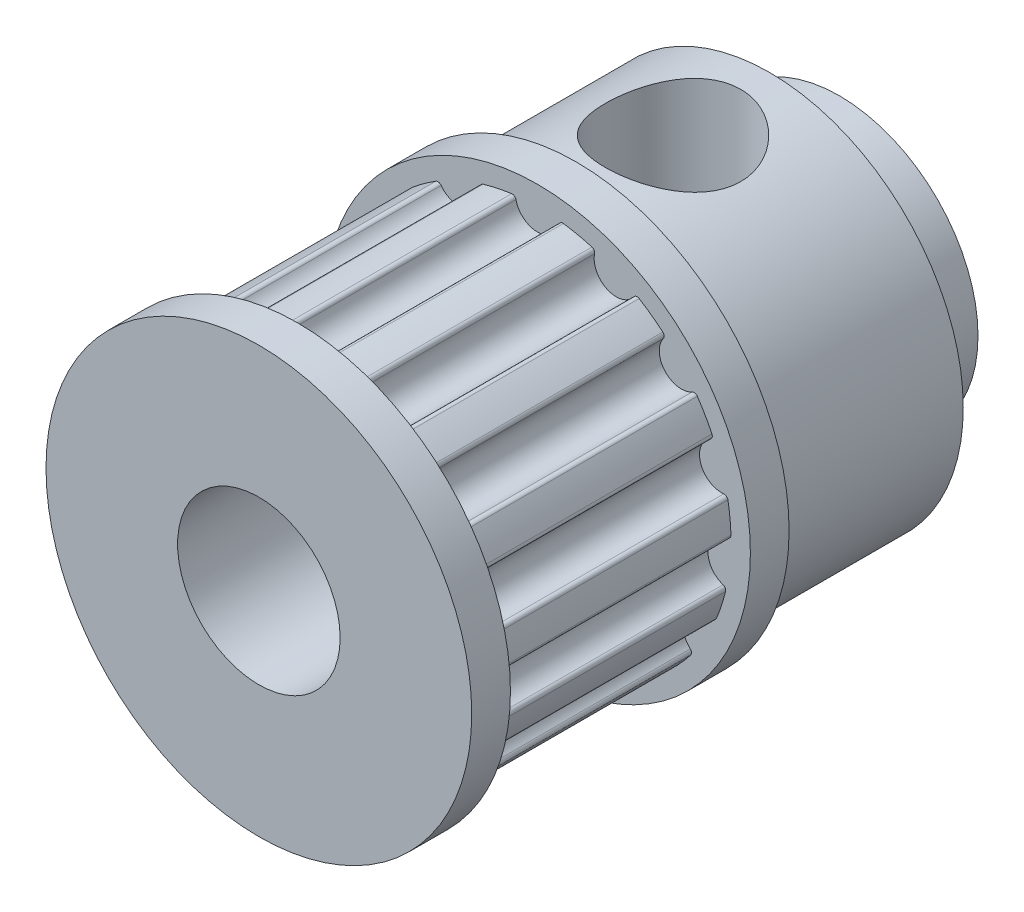
from build123d import *

# Parameters (mm, degrees)
ESBO_O1_R                = 5
ESBO_O1_R_2              = 2.1
RESSALTO_EXTRUS_O1_DEPTH = 13.2
RESSALTO_EXTRUS_O2_START = -15
ESBO_O2_R                = 3.581
ESBO_O2_R_2              = 2.1
RESSALTO_EXTRUS_O2_DEPTH = 15
ESBO_O7_R                = 0.57
CORTE_EXTRUS_O2_DEPTH    = 8
FILETE1_R                = 0.1
ESBO_O3_R                = 5.5
ESBO_O3_R_2              = 2.1
RESSALTO_EXTRUS_O3_DEPTH = 1
RESSALTO_EXTRUS_O4_START = -1
ESBO_O4_R                = 5.5
ESBO_O4_R_2              = 2.1
RESSALTO_EXTRUS_O4_DEPTH = 1
ESBO_O6_R                = 1.75
CORTE_EXTRUS_O1_DEPTH    = 16.321227177
FILETE2_R                = 0.5


with BuildPart() as part:
    # Esboço1 → Ressalto-extrusão1 (new body)
    with BuildSketch(Plane.XY):
        Circle(ESBO_O1_R)
        Circle(ESBO_O1_R_2, mode=Mode.SUBTRACT)
    extrude(amount=RESSALTO_EXTRUS_O1_DEPTH)

    # Esboço2 → Ressalto-extrusão2 (add)
    with BuildSketch(Plane.XY.offset(13.2).offset(RESSALTO_EXTRUS_O2_START)):
        Circle(ESBO_O2_R)
        Circle(ESBO_O2_R_2, mode=Mode.SUBTRACT)
    extrude(amount=RESSALTO_EXTRUS_O2_DEPTH)

    # Esboço7 → Corte-extrusão2 (cut)
    with BuildSketch(Plane.XY.offset(13.2)):
        with Locations((0, 5)):
            Circle(ESBO_O7_R)
        with Locations((2.033683215, 4.567727288)):
            Circle(ESBO_O7_R)
        with Locations((3.715724127, 3.345653032)):
            Circle(ESBO_O7_R)
        with Locations((4.755282581, 1.545084972)):
            Circle(ESBO_O7_R)
        with Locations((4.972609477, -0.522642316)):
            Circle(ESBO_O7_R)
        with Locations((4.330127019, -2.5)):
            Circle(ESBO_O7_R)
        with Locations((2.938926261, -4.045084972)):
            Circle(ESBO_O7_R)
        with Locations((1.039558454, -4.890738004)):
            Circle(ESBO_O7_R)
        with Locations((-1.039558454, -4.890738004)):
            Circle(ESBO_O7_R)
        with Locations((-2.938926261, -4.045084972)):
            Circle(ESBO_O7_R)
        with Locations((-4.330127019, -2.5)):
            Circle(ESBO_O7_R)
        with Locations((-4.972609477, -0.522642316)):
            Circle(ESBO_O7_R)
        with Locations((-4.755282581, 1.545084972)):
            Circle(ESBO_O7_R)
        with Locations((-3.715724127, 3.345653032)):
            Circle(ESBO_O7_R)
        with Locations((-2.033683215, 4.567727288)):
            Circle(ESBO_O7_R)
    extrude(amount=-CORTE_EXTRUS_O2_DEPTH, mode=Mode.SUBTRACT)

    # Filete1
    filete1_edges = [part.edges().sort_by_distance(p)[0] for p in [
        (-1.50059403, 4.769509153, 9.2),
        (-0.569073282, 4.96751, 9.2),
        (-2.459439163, -4.353292892, 9.2),
        (-4.017453213, -2.976586919, 9.2),
        (-4.880813105, -1.085202025, 9.2),
        (-4.586526494, -1.990923081, 9.2),
        (-3.380219075, -3.684307127, 9.2),
        (0.476165738, -4.977274976, 9.2),
        (-1.589441068, -4.740641, 9.2),
        (1.589441068, -4.740641, 9.2),
        (2.459439163, -4.353292892, 9.2),
        (-0.476165738, -4.977274976, 9.2),
        (-4.999781816, 0.046709652, 9.2),
        (-4.90023607, 0.993824157, 9.2),
        (3.380219075, -3.684307127, 9.2),
        (4.017453213, -2.976586919, 9.2),
        (4.586526494, -1.990923081, 9.2),
        (4.880813105, -1.085202025, 9.2),
        (4.999781816, 0.046709652, 9.2),
        (4.90023607, 0.993824157, 9.2),
        (4.54852944, 2.076265863, 9.2),
        (4.072363702, 2.901009114, 9.2),
        (3.310795002, 3.746816843, 9.2),
        (2.540342653, 4.30658324, 9.2),
        (-4.54852944, 2.076265863, 9.2),
        (-4.072363702, 2.901009114, 9.2),
        (-3.310795002, 3.746816843, 9.2),
        (-2.540342653, 4.30658324, 9.2),
        (1.50059403, 4.769509153, 9.2),
        (0.569073282, 4.96751, 9.2),
    ]]
    fillet(filete1_edges, radius=FILETE1_R)

    # Esboço3 → Ressalto-extrusão3 (add)
    with BuildSketch(Plane(origin=(0, 0, 5), x_dir=(-1, 0, 0), z_dir=(0, 0, -1))):
        Circle(ESBO_O3_R)
        Circle(ESBO_O3_R_2, mode=Mode.SUBTRACT)
    extrude(amount=-RESSALTO_EXTRUS_O3_DEPTH)

    # Esboço4 → Ressalto-extrusão4 (add)
    with BuildSketch(Plane.XY.offset(13.2).offset(RESSALTO_EXTRUS_O4_START)):
        Circle(ESBO_O4_R)
        Circle(ESBO_O4_R_2, mode=Mode.SUBTRACT)
    extrude(amount=RESSALTO_EXTRUS_O4_DEPTH)

    # Esboço6 → Corte-extrusão1 (cut, through all)
    with BuildSketch(Plane(origin=(0, 0, 0), x_dir=(1, 0, 0), z_dir=(0, 1, 0))):
        with Locations((0, -2.5)):
            Circle(ESBO_O6_R)
    extrude(amount=CORTE_EXTRUS_O1_DEPTH, mode=Mode.SUBTRACT)

    # Filete2
    filete2_edges = [part.edges().sort_by_distance(p)[0] for p in [
        (-2.1, 0, -1.8),
    ]]
    fillet(filete2_edges, radius=FILETE2_R)


solid = part.part
